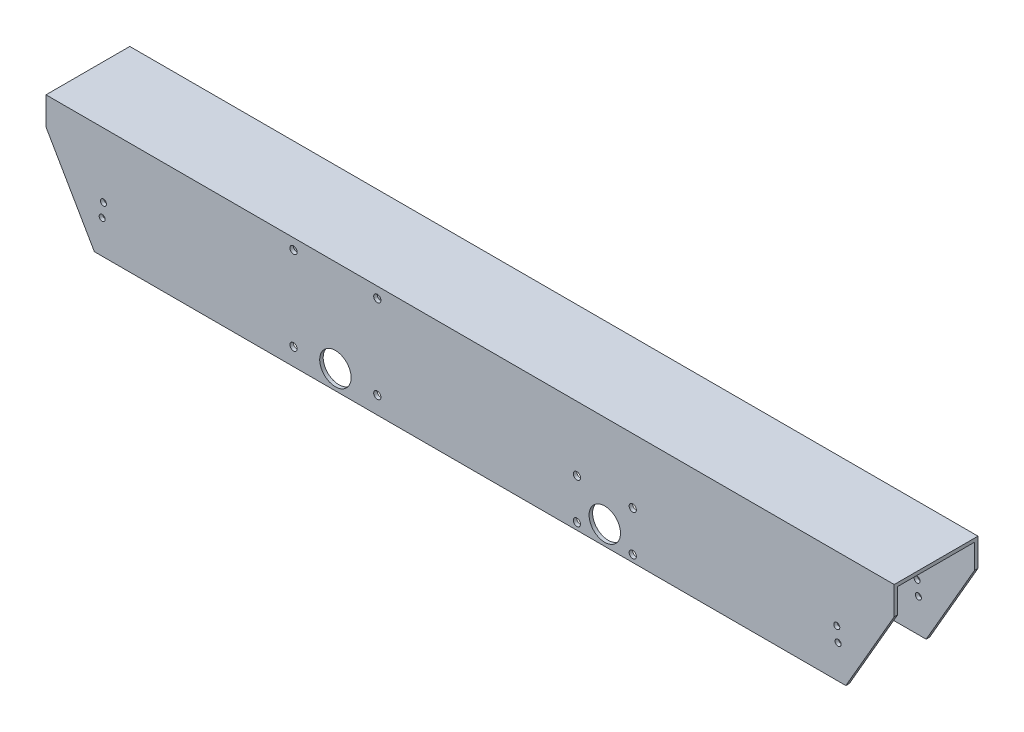
from build123d import *

# Parameters (mm, degrees)
BOSS_EXTRUDE1_DEPTH                     = 385.705756272
BEVELED_ENDS_DEPTH                      = 101.6
SKETCH2_R                               = 2.749999961
SKETCH2_R_2                             = 14.2875
SKETCH2_R_3                             = 2.75
SKETCH2_R_4                             = 3.302
AXLES_DEPTH                             = 141.732
FLANIGAN_MOUNTING_HOLES_R               = 3.3
FLANIGAN_MOUNTING_HOLES_EXTRUSION_DEPTH = 397.429073633


with BuildPart() as part:
    # Sketch1 → Boss-Extrude1 (new, symmetric)
    with BuildSketch(Plane(origin=(0, 0, 0), x_dir=(0, 0, -1), z_dir=(1, 0, 0))):
        Polygon((-38.1, 50.8), (38.1, 50.8), (38.1, -50.8), (34.925, -50.8), (34.925, 47.625), (-34.925, 47.625), (-34.925, -50.8), (-38.1, -50.8), align=None)
    extrude(amount=BOSS_EXTRUDE1_DEPTH, both=True)

    # Sketch16 → Beveled ends (cut)
    with BuildSketch(Plane.XY.offset(38.1)):
        Polygon((-385.705756272, 25.4), (-341.71166576, -50.8), (-385.705756272, -50.8), align=None)
        Polygon((341.71166576, -50.8), (385.705756272, -50.8), (385.705756272, 25.4), align=None)
    extrude(amount=-BEVELED_ENDS_DEPTH, mode=Mode.SUBTRACT)

    # Sketch2 → Axles (cut)
    with BuildSketch(Plane.XY.offset(38.1)):
        with Locations((-333.476515281, -7.874)):
            Circle(SKETCH2_R)
        with Locations((122.5, -33.274)):
            Circle(SKETCH2_R_2)
        with Locations((334.620154629, -20.574)):
            Circle(SKETCH2_R_3)
        with Locations((333.476515281, -7.874)):
            Circle(SKETCH2_R)
        with Locations((-160.6, -35.12)):
            Circle(SKETCH2_R_4)
        with Locations((-160.6, 41.08)):
            Circle(SKETCH2_R_4)
        with Locations((-122.5, -33.274)):
            Circle(SKETCH2_R_2)
        with Locations((-334.620154629, -20.574)):
            Circle(SKETCH2_R_3)
        with Locations((-84.4, 41.08)):
            Circle(SKETCH2_R_4)
        with Locations((-84.4, -35.12)):
            Circle(SKETCH2_R_4)
    extrude(amount=-AXLES_DEPTH, mode=Mode.SUBTRACT)

    # Flanigan mounting holes → Flanigan mounting holes extrusion (cut, through all)
    with BuildSketch(Plane.XY.offset(38.1)):
        with Locations((97.1, -7.87)):
            Circle(FLANIGAN_MOUNTING_HOLES_R)
        with Locations((97.1, -44.45)):
            Circle(FLANIGAN_MOUNTING_HOLES_R)
        with Locations((147.9, -7.874)):
            Circle(FLANIGAN_MOUNTING_HOLES_R)
        with Locations((147.9, -44.45)):
            Circle(FLANIGAN_MOUNTING_HOLES_R)
    extrude(amount=-FLANIGAN_MOUNTING_HOLES_EXTRUSION_DEPTH, mode=Mode.SUBTRACT)


solid = part.part
